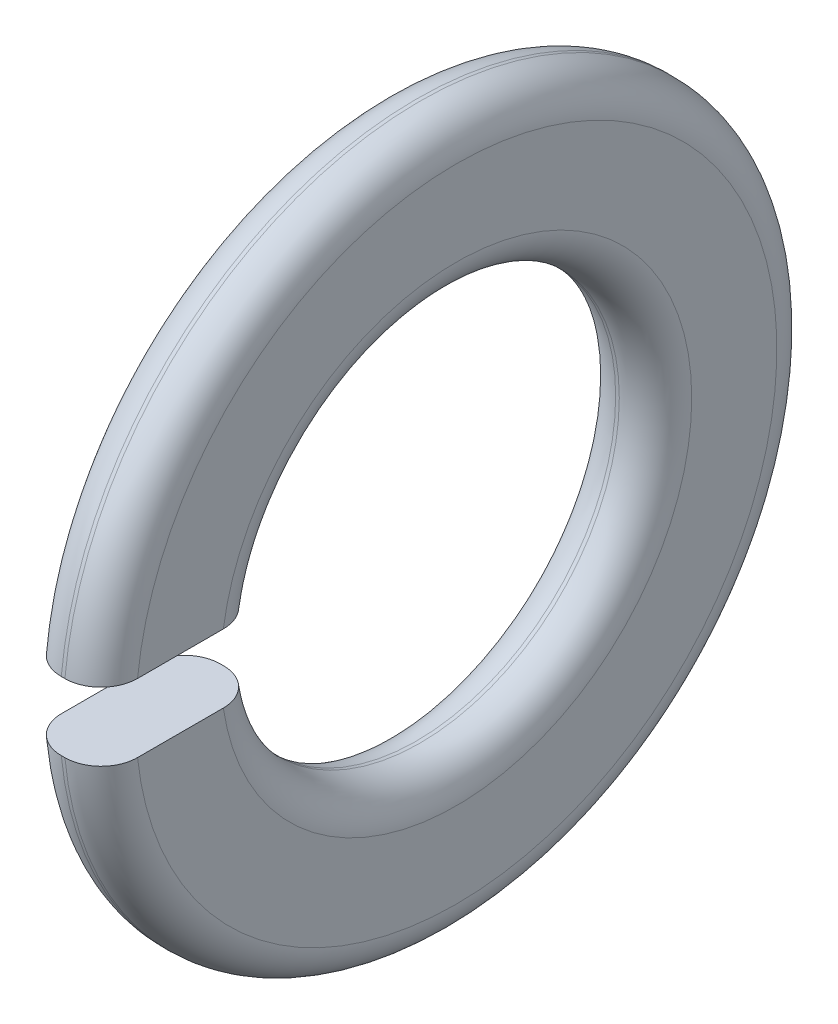
from build123d import *

# Parameters (mm, degrees)
SKETCH2_W = 1.89
SKETCH2_H = 10.047
GAP_DEPTH = 15.087405793


with BuildPart() as part:
    # Sketch1 → Base-Revolve (revolve)
    with BuildSketch(Plane.XY):
        with BuildLine():
            Line((0, 6.5), (0, 8.85))
            ThreePointArc((0, 8.85), (-0.292893219, 9.557106781), (-1, 9.85))
            Line((-1, 9.85), (-1.1, 9.85))
            ThreePointArc((-1.1, 9.85), (-1.807106781, 9.557106781), (-2.1, 8.85))
            Line((-2.1, 8.85), (-2.1, 6.5))
            ThreePointArc((-2.1, 6.5), (-1.807106781, 5.792893219), (-1.1, 5.5))
            Line((-1.1, 5.5), (-1, 5.5))
            ThreePointArc((-1, 5.5), (-0.292893219, 5.792893219), (0, 6.5))
        make_face()
    revolve(axis=Axis((-34.925, 0, 0), (1, 0, 0)))

    # Sketch2 → Gap (cut, through all)
    with BuildSketch(Plane(origin=(0, 0, 0), x_dir=(0, -1, 0), z_dir=(-1, 0, 0))):
        with Locations((0, 5.0235)):
            Rectangle(SKETCH2_W, SKETCH2_H)
    extrude(amount=GAP_DEPTH, mode=Mode.SUBTRACT)


solid = part.part
